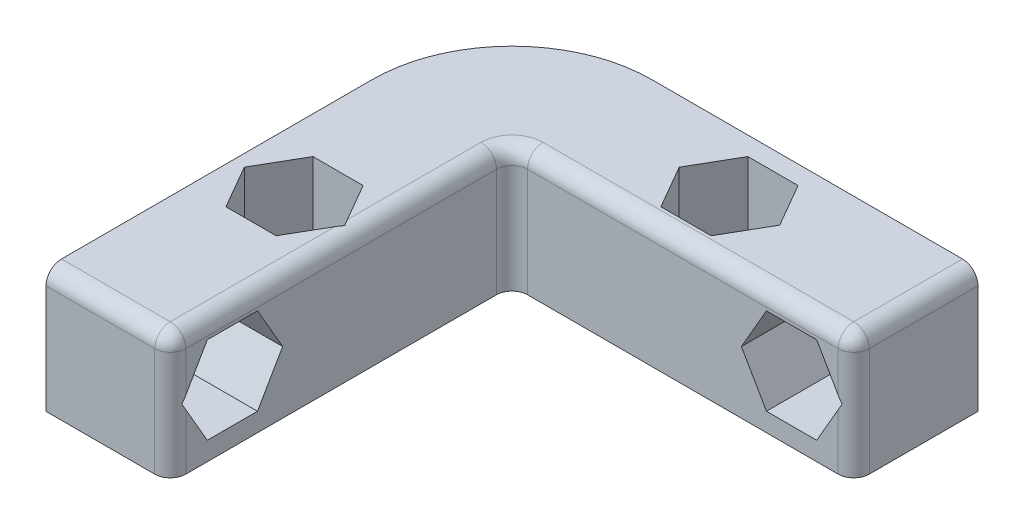
from build123d import *

# Parameters (mm, degrees)
EXTRU_MINCE1_DEPTH      = 8
ENL_V_MAT_EXTRU_1_REACH = 45.174
ESQUISSE2_R             = 1.6
ENL_V_MAT_EXTRU_2_DEPTH = 5.5
ENL_V_MAT_EXTRU_3_REACH = 45.174
ESQUISSE4_R             = 1.6
ENL_V_MAT_EXTRU_4_DEPTH = 5.5
CONG_1_R                = 1


with BuildPart() as part:
    # Esquisse1 → Extru.-Mince1 (new body)
    with BuildSketch(Plane(origin=(0, 0, 0), x_dir=(1, 0, 0), z_dir=(0, 1, 0))):
        with BuildLine():
            Line((30, 0), (9, 0))
            ThreePointArc((9, 0), (2.636038969, -2.636038969), (0, -9))
            Line((0, -9), (0, -30))
            Line((0, -30), (8, -30))
            Line((8, -30), (8, -9))
            ThreePointArc((8, -9), (8.292893219, -8.292893219), (9, -8))
            Line((9, -8), (30, -8))
            Line((30, -8), (30, 0))
        make_face()
    extrude(amount=EXTRU_MINCE1_DEPTH)

    # Esquisse2 → Enlèv. mat.-Extru.1 (cut, up to next)
    with BuildSketch(Plane.XZ, mode=Mode.PRIVATE) as enl_v_mat_extru_1_sk1:
        with Locations(Location((18, 4, 0), (0, 0, 270))):
            Circle(ESQUISSE2_R)
    enl_v_mat_extru_1_tool1 = extrude(enl_v_mat_extru_1_sk1.sketch, amount=-ENL_V_MAT_EXTRU_1_REACH, mode=Mode.PRIVATE) & part.part
    # Esquisse2 → Enlèv. mat.-Extru.1 (cut, up to next)
    with BuildSketch(Plane.XZ, mode=Mode.PRIVATE) as enl_v_mat_extru_1_sk2:
        with Locations(Location((4, 18, 0), (0, 0, 270))):
            Circle(ESQUISSE2_R)
    enl_v_mat_extru_1_tool2 = extrude(enl_v_mat_extru_1_sk2.sketch, amount=-ENL_V_MAT_EXTRU_1_REACH, mode=Mode.PRIVATE) & part.part
    add(enl_v_mat_extru_1_tool1.solids().sort_by_distance((18, 0, 4))[0], mode=Mode.SUBTRACT)
    add(enl_v_mat_extru_1_tool2.solids().sort_by_distance((4, 0, 18))[0], mode=Mode.SUBTRACT)

    # Esquisse3 → Enlèv. mat.-Extru.2 (cut)
    with BuildSketch(Plane(origin=(0, 8, 0), x_dir=(1, 0, 0), z_dir=(0, 1, 0))):
        Polygon((5.616580754, -20.8), (7.233161507, -18), (5.616580754, -15.2), (2.383419246, -15.2), (0.766838493, -18), (2.383419246, -20.8), align=None)
        Polygon((19.616580754, -6.8), (21.233161507, -4), (19.616580754, -1.2), (16.383419246, -1.2), (14.766838493, -4), (16.383419246, -6.8), align=None)
    extrude(amount=-ENL_V_MAT_EXTRU_2_DEPTH, mode=Mode.SUBTRACT)

    # Esquisse4 → Enlèv. mat.-Extru.3 (cut, up to next)
    with BuildSketch(Plane(origin=(0, 0, 0), x_dir=(-1, 0, 0), z_dir=(0, 0, -1)), mode=Mode.PRIVATE) as enl_v_mat_extru_3_sk1:
        with Locations((-26, 4)):
            Circle(ESQUISSE4_R)
    enl_v_mat_extru_3_tool1 = extrude(enl_v_mat_extru_3_sk1.sketch, amount=-ENL_V_MAT_EXTRU_3_REACH, mode=Mode.PRIVATE) & part.part
    enl_v_mat_extru_3 = enl_v_mat_extru_3_tool1.solids().sort_by_distance((26, 4, 0))[0]
    add(enl_v_mat_extru_3, mode=Mode.SUBTRACT)

    # Esquisse5 → Enlèv. mat.-Extru.4 (cut)
    with BuildSketch(Plane.XY.offset(8)):
        Polygon((27.616580754, 1.2), (29.233161507, 4), (27.616580754, 6.8), (24.383419246, 6.8), (22.766838493, 4), (24.383419246, 1.2), align=None)
    enl_v_mat_extru_4 = extrude(amount=-ENL_V_MAT_EXTRU_4_DEPTH, mode=Mode.SUBTRACT)

    # Symétrie1: Enlèv. mat.-Extru.3, Enlèv. mat.-Extru.4 across plane
    add(enl_v_mat_extru_3.mirror(Plane(origin=(0, 0, 0), x_dir=(0.7071067811865476, 0, 0.7071067811865475), z_dir=(0.7071067811865475, 0, -0.7071067811865476))), mode=Mode.SUBTRACT)
    add(enl_v_mat_extru_4.mirror(Plane(origin=(0, 0, 0), x_dir=(0.7071067811865476, 0, 0.7071067811865475), z_dir=(0.7071067811865475, 0, -0.7071067811865476))), mode=Mode.SUBTRACT)

    # Congé1
    # the kernel refuses this fillet: 1 mm, written as the material it takes off along each edge
    with BuildSketch(Plane(origin=(7, 7, 29), x_dir=(0, 1, 0), z_dir=(1, 0, 0))) as cong_1_piece_1_section:
        Polygon((0, 0), (CONG_1_R, 0), (CONG_1_R, CONG_1_R), (0, CONG_1_R), align=None)
    cong_1_piece_1 = extrude(amount=CONG_1_R, mode=Mode.PRIVATE)
    cong_1_piece_1 = cong_1_piece_1 - Plane(origin=(7, 7, 29), x_dir=(0, -0.7071067811865475, -0.7071067811865475), z_dir=(1, 0, 0)) * Sphere(CONG_1_R, mode=Mode.PRIVATE)
    add(cong_1_piece_1, mode=Mode.SUBTRACT)
    with BuildSketch(Plane(origin=(29, 7, 7), x_dir=(0, 1, 0), z_dir=(0, 0, 1))) as cong_1_piece_2_section:
        Polygon((0, 0), (CONG_1_R, 0), (CONG_1_R, -CONG_1_R), (0, -CONG_1_R), align=None)
    cong_1_piece_2 = extrude(amount=CONG_1_R, mode=Mode.PRIVATE)
    cong_1_piece_2 = cong_1_piece_2 - Plane(origin=(29, 7, 7), x_dir=(-0.7071067811865475, -0.7071067811865475, 0), z_dir=(0, 0, 1)) * Sphere(CONG_1_R, mode=Mode.PRIVATE)
    add(cong_1_piece_2, mode=Mode.SUBTRACT)
    with BuildSketch(Plane(origin=(8, 8, 29), x_dir=(-1, 0, 0), z_dir=(0, 0, -1))) as cong_1_piece_3:
        with BuildLine():
            CenterArc((CONG_1_R, -CONG_1_R), CONG_1_R, 90, 90)
            Line((0, -CONG_1_R), (0, 0))
            Line((0, 0), (CONG_1_R, 0))
        make_face()
    extrude(amount=20, mode=Mode.SUBTRACT)
    with BuildSketch(Plane(origin=(30, -2.5, 8), x_dir=(-1, 0, 0), z_dir=(0, 1, 0)), Plane(origin=(30, 8, 7), x_dir=(-1, 0, 0), z_dir=(0, 0, -1)), Plane(origin=(-2.5, 8, 30), x_dir=(0, 0, -1), z_dir=(1, 0, 0))) as cong_1_piece_4:
        with BuildLine():
            CenterArc((CONG_1_R, -CONG_1_R), CONG_1_R, 90, 90)
            Line((0, -CONG_1_R), (0, 0))
            Line((0, 0), (CONG_1_R, 0))
        make_face()
    extrude(amount=9.5, mode=Mode.SUBTRACT)
    with BuildSketch(Plane(origin=(8, -2.5, 30), x_dir=(0, 0, -1), z_dir=(0, 1, 0))) as cong_1_piece_5:
        with BuildLine():
            CenterArc((CONG_1_R, CONG_1_R), CONG_1_R, 180, 90)
            Line((0, CONG_1_R), (0, 0))
            Line((0, 0), (CONG_1_R, 0))
        make_face()
    extrude(amount=9.5, mode=Mode.SUBTRACT)
    with BuildSketch(Plane(origin=(9, 8, 9), x_dir=(-1, 0, 0), z_dir=(0, 0, 1))) as cong_1_piece_6:
        with BuildLine():
            CenterArc((1 + CONG_1_R, CONG_1_R), CONG_1_R, 180, 90)
            Line((1 + CONG_1_R, 0), (1, 0))
            Line((1, 0), (1, CONG_1_R))
        make_face()
    revolve(axis=Axis((9, 8, 9), (0, -1, 0)), revolution_arc=90, mode=Mode.SUBTRACT)
    with BuildSketch(Plane(origin=(9, 8, 8), x_dir=(0, -1, 0), z_dir=(1, 0, 0))) as cong_1_piece_7:
        with BuildLine():
            CenterArc((CONG_1_R, CONG_1_R), CONG_1_R, 180, 90)
            Line((0, CONG_1_R), (0, 0))
            Line((0, 0), (CONG_1_R, 0))
        make_face()
    extrude(amount=20, mode=Mode.SUBTRACT)


solid = part.part
